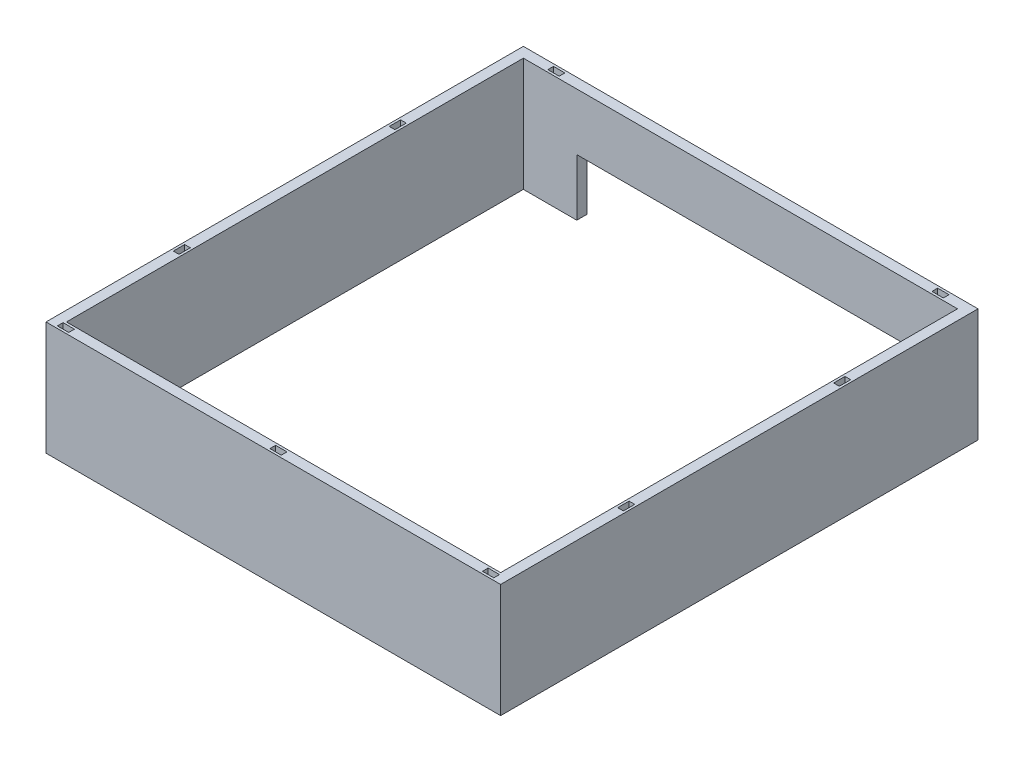
from build123d import *

# Parameters (mm, degrees)
SKETCH1_W        = 200
SKETCH1_H        = 210
SKETCH1_W_2      = 191
SKETCH1_H_2      = 201
SKETCH1_W_3      = 5
SKETCH1_H_3      = 2.5
SKETCH1_W_4      = 2.5
SKETCH1_H_4      = 5
MAINBODY_DEPTH   = 50
IRHOLE_START     = -4.5
IRHOLE_OUTLINE_W = 144
IRHOLE_OUTLINE_H = 25
IRHOLE_DEPTH     = 4.5


# Read off the part's stored shape, not the designer's step: IRHole
with BuildPart() as part:
    # Sketch1 → MainBody (new body)
    with BuildSketch(Plane(origin=(0, 0, 0), x_dir=(1, 0, 0), z_dir=(0, 1, 0))):
        Rectangle(SKETCH1_W, SKETCH1_H)
        Rectangle(SKETCH1_W_2, SKETCH1_H_2, mode=Mode.SUBTRACT)
        with Locations((93.5, -102.75)):
            Rectangle(SKETCH1_W_3, SKETCH1_H_3, mode=Mode.SUBTRACT)
        with Locations((0, -102.75)):
            Rectangle(SKETCH1_W_3, SKETCH1_H_3, mode=Mode.SUBTRACT)
        with Locations((-93.5, -102.75)):
            Rectangle(SKETCH1_W_3, SKETCH1_H_3, mode=Mode.SUBTRACT)
        with Locations((-83.25, 102.75)):
            Rectangle(SKETCH1_W_3, SKETCH1_H_3, mode=Mode.SUBTRACT)
        with Locations((85.75, 102.75)):
            Rectangle(SKETCH1_W_3, SKETCH1_H_3, mode=Mode.SUBTRACT)
        with Locations((97.75, -47.5)):
            Rectangle(SKETCH1_W_4, SKETCH1_H_4, mode=Mode.SUBTRACT)
        with Locations((97.75, 47.5)):
            Rectangle(SKETCH1_W_4, SKETCH1_H_4, mode=Mode.SUBTRACT)
        with Locations((-97.75, -47.5)):
            Rectangle(SKETCH1_W_4, SKETCH1_H_4, mode=Mode.SUBTRACT)
        with Locations((-97.75, 47.5)):
            Rectangle(SKETCH1_W_4, SKETCH1_H_4, mode=Mode.SUBTRACT)
    extrude(amount=MAINBODY_DEPTH)

    # IRHole outline → IRHole (cut)
    with BuildSketch(Plane(origin=(0, 0, -105), x_dir=(-1, 0, 0), z_dir=(0, 0, -1)).offset(IRHOLE_START)):
        with Locations((0, 12.5)):
            Rectangle(IRHOLE_OUTLINE_W, IRHOLE_OUTLINE_H)
    extrude(amount=IRHOLE_DEPTH, mode=Mode.SUBTRACT)


solid = part.part
